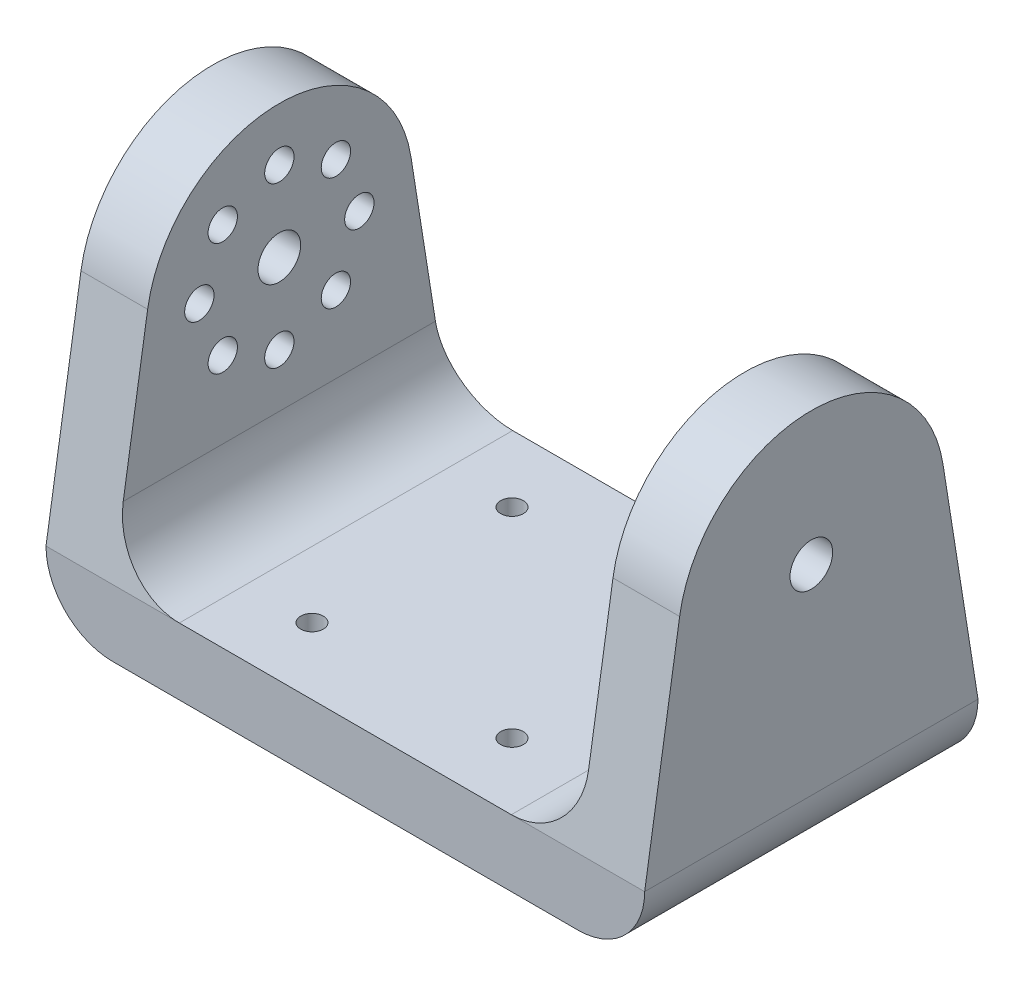
from build123d import *

# Parameters (mm, degrees)
SKETCH_1_W          = 44.9
SKETCH_1_H          = 25
EXTRUDE_1_DEPTH     = 5
SKETCH_2_R          = 1.1
SKETCH_2_R_2        = 1.6
EXTRUDE_2_DEPTH     = 5
EXTRUDE_START       = -5
SKETCH_3_R          = 1.6
EXTRUDE_3_DEPTH     = 5
FILLET_1_R          = 5
SKETCH_4_R          = 0.85
CUT_EXTRUDE_1_DEPTH = 5


with BuildPart() as part:
    # ｽｹｯﾁ1 → ﾎﾞｽ - 押し出し1 (new body)
    with BuildSketch(Plane(origin=(0, 0, 0), x_dir=(1, 0, 0), z_dir=(0, 1, 0))):
        with Locations((0, 12.5)):
            Rectangle(SKETCH_1_W, SKETCH_1_H)
    extrude(amount=EXTRUDE_1_DEPTH)

    # ｽｹｯﾁ2 → ﾎﾞｽ - 押し出し2 (add)
    with BuildSketch(Plane.ZY.offset(22.45)):
        with BuildLine():
            Line((-25, 5), (0, 5))
            Line((0, 5), (-2.623078099, 21.564101584))
            ThreePointArc((-2.623078099, 21.564101584), (-12.5, 30), (-22.376921901, 21.564101584))
            Line((-22.376921901, 21.564101584), (-25, 5))
        make_face()
        with Locations((-12.5, 26)):
            Circle(SKETCH_2_R, mode=Mode.SUBTRACT)
        with Locations((-8.257359313, 24.242640687)):
            Circle(SKETCH_2_R, mode=Mode.SUBTRACT)
        with Locations((-6.5, 20)):
            Circle(SKETCH_2_R, mode=Mode.SUBTRACT)
        with Locations((-8.257359313, 15.757359313)):
            Circle(SKETCH_2_R, mode=Mode.SUBTRACT)
        with Locations((-12.5, 14)):
            Circle(SKETCH_2_R, mode=Mode.SUBTRACT)
        with Locations((-16.742640687, 15.757359313)):
            Circle(SKETCH_2_R, mode=Mode.SUBTRACT)
        with Locations((-18.5, 20)):
            Circle(SKETCH_2_R, mode=Mode.SUBTRACT)
        with Locations((-16.742640687, 24.242640687)):
            Circle(SKETCH_2_R, mode=Mode.SUBTRACT)
        with Locations((-12.5, 20)):
            Circle(SKETCH_2_R_2, mode=Mode.SUBTRACT)
    extrude(amount=-EXTRUDE_2_DEPTH)

    # ｽｹｯﾁ3 → ﾎﾞｽ - 押し出し3 (add)
    with BuildSketch(Plane(origin=(22.45, 0, 0), x_dir=(0, 0, -1), z_dir=(1, 0, 0)).offset(EXTRUDE_START)):
        with BuildLine():
            Line((0, 5), (2.623078099, 21.564101584))
            ThreePointArc((2.623078099, 21.564101584), (12.5, 30), (22.376921901, 21.564101584))
            Line((22.376921901, 21.564101584), (25, 5))
            Line((25, 5), (0, 5))
        make_face()
        with Locations((12.5, 20)):
            Circle(SKETCH_3_R, mode=Mode.SUBTRACT)
    extrude(amount=EXTRUDE_3_DEPTH)

    # ﾌｨﾚｯﾄ1
    fillet_1_edges = [part.edges().sort_by_distance(p)[0] for p in [
        (17.45, 5, -12.5),
        (-17.45, 5, -12.5),
        (22.45, 0, -12.5),
        (-22.45, 0, -12.5),
    ]]
    fillet(fillet_1_edges, radius=FILLET_1_R)

    # ｽｹｯﾁ4 → ｶｯﾄ - 押し出し1 (cut)
    with BuildSketch(Plane(origin=(0, 5, 0), x_dir=(1, 0, 0), z_dir=(0, 1, 0))):
        with Locations((-7.5, 20)):
            Circle(SKETCH_4_R)
        with Locations((7.5, 20)):
            Circle(SKETCH_4_R)
        with Locations((7.5, 5)):
            Circle(SKETCH_4_R)
        with Locations((-7.5, 5)):
            Circle(SKETCH_4_R)
    extrude(amount=-CUT_EXTRUDE_1_DEPTH, mode=Mode.SUBTRACT)


solid = part.part
